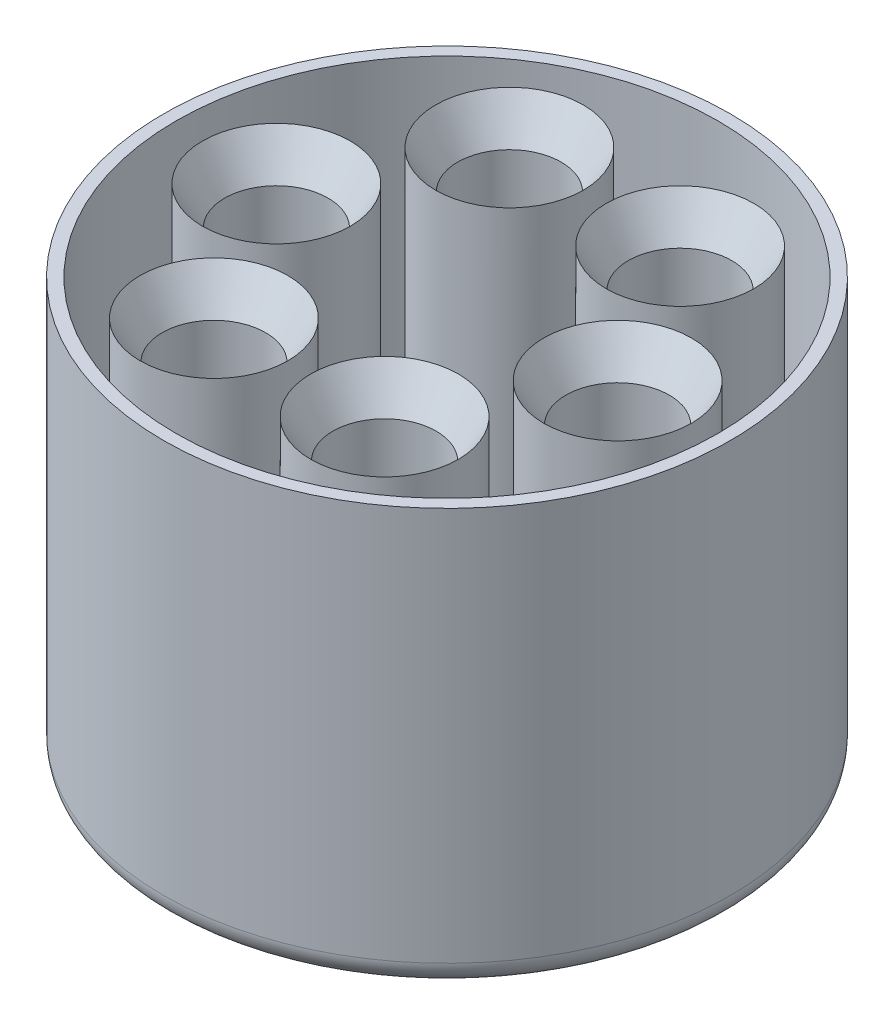
from build123d import *

# Parameters (mm, degrees)
SKETCH2_R             = 15
SKETCH2_R_2           = 10.5
BOSS_EXTRUDE1_DEPTH   = 75
BOSS_EXTRUDE1_2_DEPTH = 75
BOSS_EXTRUDE1_3_DEPTH = 75
BOSS_EXTRUDE1_4_DEPTH = 75
BOSS_EXTRUDE1_5_DEPTH = 75
BOSS_EXTRUDE1_6_DEPTH = 75
SKETCH2_R_3           = 57.5
SKETCH2_R_4           = 55
BOSS_EXTRUDE1_7_DEPTH = 75
SKETCH3_R             = 57.5
BOSS_EXTRUDE2_DEPTH   = 10
CHAMFER2_SIZE         = 5
CHAMFER2_SIZE_2       = 8.660254038
FILLET1_R             = 5


with BuildPart() as part:
    # Sketch2 → Boss-Extrude1 (new body)
    with BuildSketch(Plane(origin=(0, 0, 0), x_dir=(1, 0, 0), z_dir=(0, 1, 0))):
        with Locations(Location((-34.641016151, 0, 0), (0, 0, 270))):
            Circle(SKETCH2_R)
        with Locations(Location((-34.641016151, 0, 0), (0, 0, 270))):
            Circle(SKETCH2_R_2, mode=Mode.SUBTRACT)
    extrude(amount=BOSS_EXTRUDE1_DEPTH)



with BuildPart() as body_2:
    # Sketch2 → Boss-Extrude1 2 (new body)
    with BuildSketch(Plane(origin=(0, 0, 0), x_dir=(1, 0, 0), z_dir=(0, 1, 0))):
        with Locations(Location((-17.320508076, 30, 0), (0, 0, 270))):
            Circle(SKETCH2_R)
        with Locations(Location((-17.320508076, 30, 0), (0, 0, 270))):
            Circle(SKETCH2_R_2, mode=Mode.SUBTRACT)
    extrude(amount=BOSS_EXTRUDE1_2_DEPTH)


with BuildPart() as body_3:
    # Sketch2 → Boss-Extrude1 3 (new body)
    with BuildSketch(Plane(origin=(0, 0, 0), x_dir=(1, 0, 0), z_dir=(0, 1, 0))):
        with Locations(Location((17.320508076, 30, 0), (0, 0, 270))):
            Circle(SKETCH2_R)
        with Locations(Location((17.320508076, 30, 0), (0, 0, 270))):
            Circle(SKETCH2_R_2, mode=Mode.SUBTRACT)
    extrude(amount=BOSS_EXTRUDE1_3_DEPTH)


with BuildPart() as body_4:
    # Sketch2 → Boss-Extrude1 4 (new body)
    with BuildSketch(Plane(origin=(0, 0, 0), x_dir=(1, 0, 0), z_dir=(0, 1, 0))):
        with Locations(Location((34.641016151, 0, 0), (0, 0, 270))):
            Circle(SKETCH2_R)
        with Locations(Location((34.641016151, 0, 0), (0, 0, 270))):
            Circle(SKETCH2_R_2, mode=Mode.SUBTRACT)
    extrude(amount=BOSS_EXTRUDE1_4_DEPTH)


with BuildPart() as body_5:
    # Sketch2 → Boss-Extrude1 5 (new body)
    with BuildSketch(Plane(origin=(0, 0, 0), x_dir=(1, 0, 0), z_dir=(0, 1, 0))):
        with Locations(Location((17.320508076, -30, 0), (0, 0, 270))):
            Circle(SKETCH2_R)
        with Locations(Location((17.320508076, -30, 0), (0, 0, 270))):
            Circle(SKETCH2_R_2, mode=Mode.SUBTRACT)
    extrude(amount=BOSS_EXTRUDE1_5_DEPTH)


with BuildPart() as body_6:
    # Sketch2 → Boss-Extrude1 6 (new body)
    with BuildSketch(Plane(origin=(0, 0, 0), x_dir=(1, 0, 0), z_dir=(0, 1, 0))):
        with Locations(Location((-17.320508076, -30, 0), (0, 0, 270))):
            Circle(SKETCH2_R)
        with Locations(Location((-17.320508076, -30, 0), (0, 0, 270))):
            Circle(SKETCH2_R_2, mode=Mode.SUBTRACT)
    extrude(amount=BOSS_EXTRUDE1_6_DEPTH)


with BuildPart() as body_7:
    # Sketch2 → Boss-Extrude1 7 (new body)
    with BuildSketch(Plane(origin=(0, 0, 0), x_dir=(1, 0, 0), z_dir=(0, 1, 0))):
        with Locations(Location((0, 0, 0), (0, 0, 270))):
            Circle(SKETCH2_R_3)
        with Locations(Location((0, 0, 0), (0, 0, 270))):
            Circle(SKETCH2_R_4, mode=Mode.SUBTRACT)
    extrude(amount=BOSS_EXTRUDE1_7_DEPTH)


with BuildPart() as part_1:
    add(part.part)

    add(body_2.part)  # Boss-Extrude2 merges body 2

    add(body_3.part)  # Boss-Extrude2 merges body 3

    add(body_4.part)  # Boss-Extrude2 merges body 4

    add(body_5.part)  # Boss-Extrude2 merges body 5

    add(body_6.part)  # Boss-Extrude2 merges body 6

    add(body_7.part)  # Boss-Extrude2 merges body 7
    # Sketch3 → Boss-Extrude2 (add)
    with BuildSketch(Plane.XZ):
        with Locations(Location((0, 0, 0), (0, 0, 270))):
            Circle(SKETCH3_R)
    extrude(amount=BOSS_EXTRUDE2_DEPTH)

    # Chamfer2
    # the kernel refuses this chamfer: 8.660254038, 5 mm, written as the material it takes off along each edge
    with BuildSketch(Plane(origin=(-17.320508076, 75, -30), x_dir=(0, 0, 1), z_dir=(-1, 0, 0))) as chamfer2_piece_1:
        Polygon((10.5 + CHAMFER2_SIZE, 0), (10.5, -CHAMFER2_SIZE_2), (10.5, 0), align=None)
    revolve(axis=Axis((-17.320508076, 75, -30), (0, 1, 0)), mode=Mode.SUBTRACT)
    with BuildSketch(Plane(origin=(-34.641016151, 75, 0), x_dir=(0, 0, 1), z_dir=(-1, 0, 0))) as chamfer2_piece_2:
        Polygon((10.5 + CHAMFER2_SIZE, 0), (10.5, -CHAMFER2_SIZE_2), (10.5, 0), align=None)
    revolve(axis=Axis((-34.641016151, 75, 0), (0, 1, 0)), mode=Mode.SUBTRACT)
    with BuildSketch(Plane(origin=(-17.320508076, 75, 30), x_dir=(0, 0, 1), z_dir=(-1, 0, 0))) as chamfer2_piece_3:
        Polygon((10.5 + CHAMFER2_SIZE, 0), (10.5, -CHAMFER2_SIZE_2), (10.5, 0), align=None)
    revolve(axis=Axis((-17.320508076, 75, 30), (0, 1, 0)), mode=Mode.SUBTRACT)
    with BuildSketch(Plane(origin=(17.320508076, 75, 30), x_dir=(0, 0, 1), z_dir=(-1, 0, 0))) as chamfer2_piece_4:
        Polygon((10.5 + CHAMFER2_SIZE, 0), (10.5, -CHAMFER2_SIZE_2), (10.5, 0), align=None)
    revolve(axis=Axis((17.320508076, 75, 30), (0, 1, 0)), mode=Mode.SUBTRACT)
    with BuildSketch(Plane(origin=(34.641016151, 75, 0), x_dir=(0, 0, 1), z_dir=(-1, 0, 0))) as chamfer2_piece_5:
        Polygon((10.5 + CHAMFER2_SIZE, 0), (10.5, -CHAMFER2_SIZE_2), (10.5, 0), align=None)
    revolve(axis=Axis((34.641016151, 75, 0), (0, 1, 0)), mode=Mode.SUBTRACT)
    with BuildSketch(Plane(origin=(17.320508076, 75, -30), x_dir=(0, 0, 1), z_dir=(-1, 0, 0))) as chamfer2_piece_6:
        Polygon((10.5 + CHAMFER2_SIZE, 0), (10.5, -CHAMFER2_SIZE_2), (10.5, 0), align=None)
    revolve(axis=Axis((17.320508076, 75, -30), (0, 1, 0)), mode=Mode.SUBTRACT)

    # Fillet1
    fillet1_edges = [part_1.edges().sort_by_distance(p)[0] for p in [
        (0, -10, 57.5),
    ]]
    fillet(fillet1_edges, radius=FILLET1_R)


solid = part_1.part
